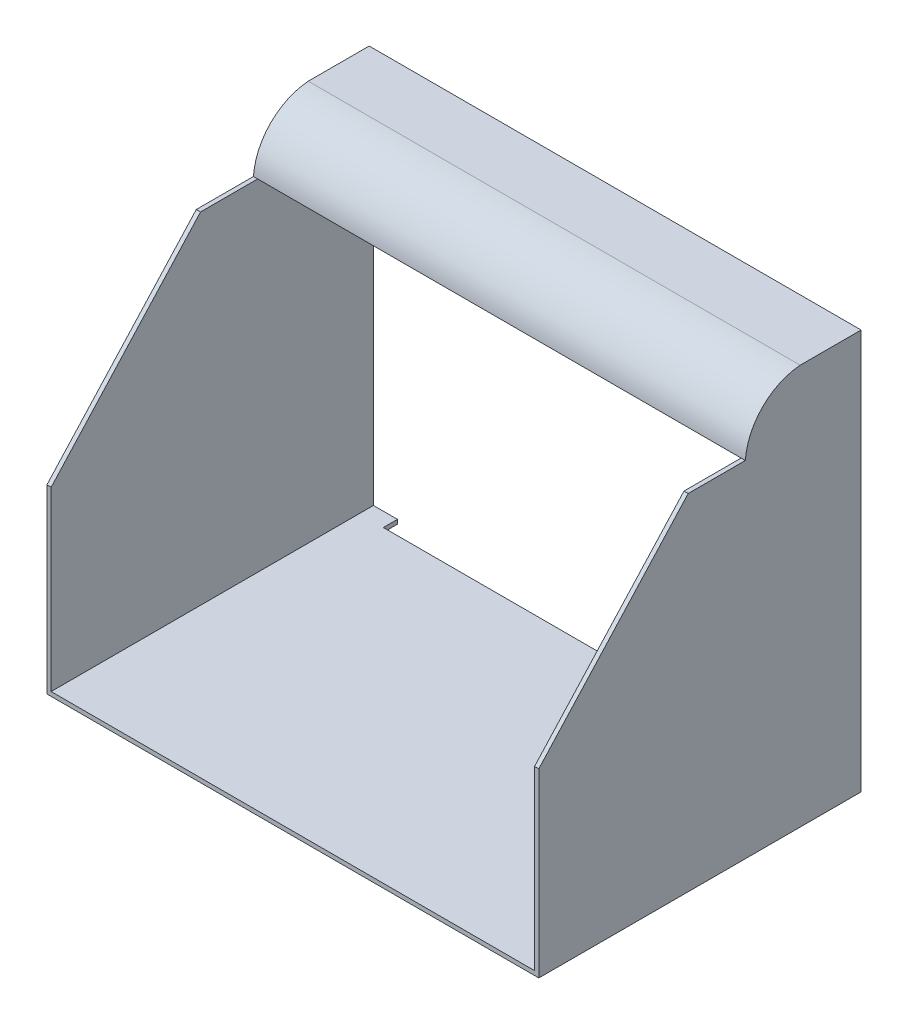
from build123d import *

# Parameters (mm, degrees)
BOSS_EXTRUDE2_DEPTH = 174
SHELL1_START        = 1.5
SHELL1_DEPTH        = 171
SKETCH2_W           = 154
SKETCH2_H           = 5
CUT_EXTRUDE1_DEPTH  = 140


# Read off the part's stored shape, not the designer's step: Shell1
with BuildPart() as part:
    # Sketch1 → Boss-Extrude2 (new body)
    with BuildSketch(Plane.YZ):
        with BuildLine():
            Line((1.5, 20.058890221), (1.5, -1.5))
            Line((1.5, -1.5), (-140, -1.5))
            Line((-140, -1.5), (-140, 112.5))
            Line((-140, 112.5), (-75.918585959, 112.5))
            Line((-75.918585959, 112.5), (-18, 59.661991757))
            Line((-18, 59.661991757), (-18, 39.44651964))
            ThreePointArc((-18, 39.44651964), (-4.649661835, 33.373910634), (1.5, 20.058890221))
        make_face()
    extrude(amount=BOSS_EXTRUDE2_DEPTH)

    # Shell1 outline → Shell1 (cut)
    with BuildSketch(Plane.YZ.offset(SHELL1_START)):
        with BuildLine():
            ThreePointArc((0, 20), (-5.689406445, 32.292423742), (-18, 37.942407235))
            Line((-18, 37.942407235), (-18, 59.661991757))
            Line((-18, 59.661991757), (-75.918585959, 112.5))
            Line((-75.918585959, 112.5), (-138.5, 112.5))
            Line((-138.5, 112.5), (-138.5, -1.5))
            Line((-138.5, -1.5), (0, -1.5))
            Line((0, -1.5), (0, 20))
        make_face()
    extrude(amount=SHELL1_DEPTH, mode=Mode.SUBTRACT)

    # Sketch2 → Cut-Extrude1 (cut)
    with BuildSketch(Plane.XZ.offset(140)):
        with Locations((87, 1)):
            Rectangle(SKETCH2_W, SKETCH2_H)
    extrude(amount=-CUT_EXTRUDE1_DEPTH, mode=Mode.SUBTRACT)


solid = part.part
